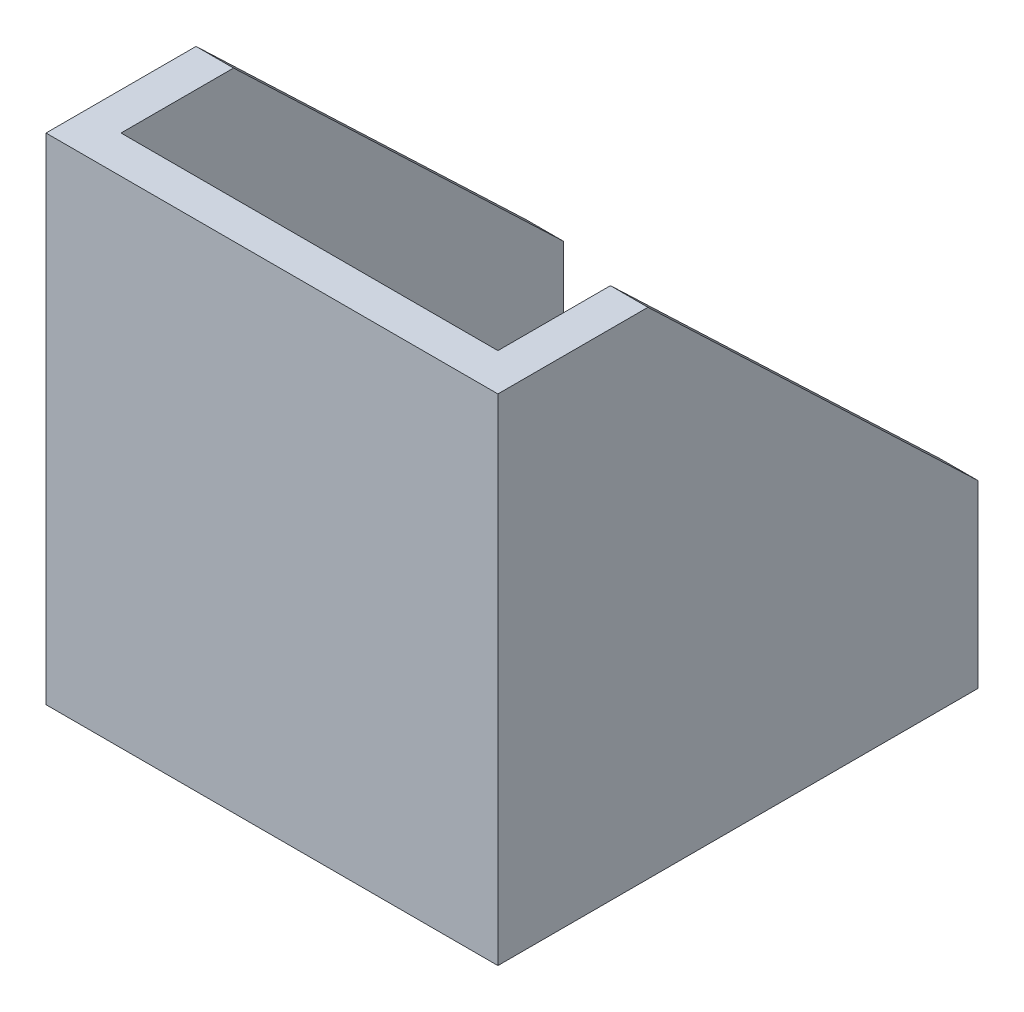
from build123d import *

# Parameters (mm, degrees)
BOSS_EXTRUDE1_DEPTH = 31
CUT_EXTRUDE1_DEPTH  = 54.780432166
SKETCH4_R           = 1.05
BOSS_EXTRUDE2_DEPTH = 2


with BuildPart() as part:
    # Sketch2 → Boss-Extrude1 (new body)
    with BuildSketch(Plane(origin=(0, 0, 0), x_dir=(1, 0, 0), z_dir=(0, 1, 0))):
        Polygon((15.061, 0), (15.061, 32), (12.561, 32), (12.561, 2.5), (-12.561, 2.5), (-12.561, 32), (-15.061, 32), (-15.061, 0), align=None)
    extrude(amount=BOSS_EXTRUDE1_DEPTH)

    # Sketch3 → Cut-Extrude1 (cut, through all)
    with BuildSketch(Plane(origin=(15.061, 0, 0), x_dir=(0, 0, -1), z_dir=(1, 0, 0))):
        Polygon((32, 10), (10, 31), (32, 31), align=None)
    extrude(amount=-CUT_EXTRUDE1_DEPTH, mode=Mode.SUBTRACT)

    # Sketch4 → Boss-Extrude2 (add)
    with BuildSketch(Plane.XZ):
        with BuildLine():
            Line((-15.061, 0), (-15.061, -32))
            Line((-15.061, -32), (-10.061, -32))
            ThreePointArc((-10.061, -32), (-7.939679656, -31.121320344), (-7.061, -29))
            Line((-7.061, -29), (-12.561, -20))
            Line((-12.561, -20), (-12.561, -10))
            Line((-12.561, -10), (-9.963851624, -7.5))
            ThreePointArc((-9.963851624, -7.5), (-8.865775413, -6.401923789), (-7.365775413, -6))
            Line((-7.365775413, -6), (7.365775413, -6))
            ThreePointArc((7.365775413, -6), (7.760955663, -6.026141804), (8.149248764, -6.10411162))
            Line((8.149248764, -6.10411162), (12.561, -10))
            Line((12.561, -10), (12.561, -20))
            Line((12.561, -20), (7.061, -29))
            ThreePointArc((7.061, -29), (7.939679656, -31.121320344), (10.061, -32))
            Line((10.061, -32), (15.061, -32))
            Line((15.061, -32), (15.061, 0))
            Line((15.061, 0), (-15.061, 0))
        make_face()
        with Locations((-10.2499, -4.95)):
            Circle(SKETCH4_R, mode=Mode.SUBTRACT)
        with Locations((-10.2499, -29.4)):
            Circle(SKETCH4_R, mode=Mode.SUBTRACT)
        with Locations((10.2499, -29.4)):
            Circle(SKETCH4_R, mode=Mode.SUBTRACT)
        with Locations((10.2499, -4.95)):
            Circle(SKETCH4_R, mode=Mode.SUBTRACT)
    extrude(amount=BOSS_EXTRUDE2_DEPTH)


solid = part.part
